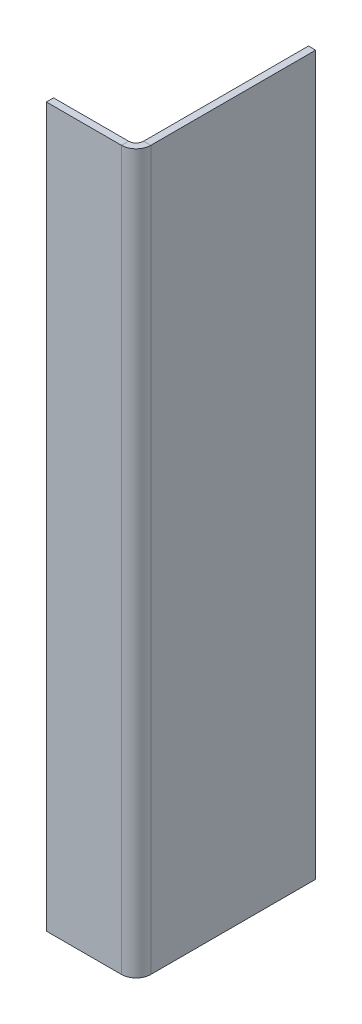
from build123d import *

# Parameters (mm, degrees)
BASE_FLANGE1_DEPTH = 152.4


# Sheet-metal steps are written as plain solids
with BuildPart() as part:
    # Sketch1 → Base-Flange1 (new, symmetric)
    with BuildSketch(Plane(origin=(0, 0, 0), x_dir=(1, 0, 0), z_dir=(0, 1, 0))):
        with BuildLine():
            Line((0, 38.1), (0, -31.88716))
            ThreePointArc((0, -31.88716), (-1.819698706, -36.280301294), (-6.21284, -38.1))
            Line((-6.21284, -38.1), (-38.1, -38.1))
            Line((-38.1, -38.1), (-38.1, -35.06216))
            Line((-38.1, -35.06216), (-6.21284, -35.06216))
            ThreePointArc((-6.21284, -35.06216), (-3.96777597, -34.13222403), (-3.03784, -31.88716))
            Line((-3.03784, -31.88716), (-3.03784, 38.1))
            Line((-3.03784, 38.1), (0, 38.1))
        make_face()
    extrude(amount=BASE_FLANGE1_DEPTH, both=True)


solid = part.part
